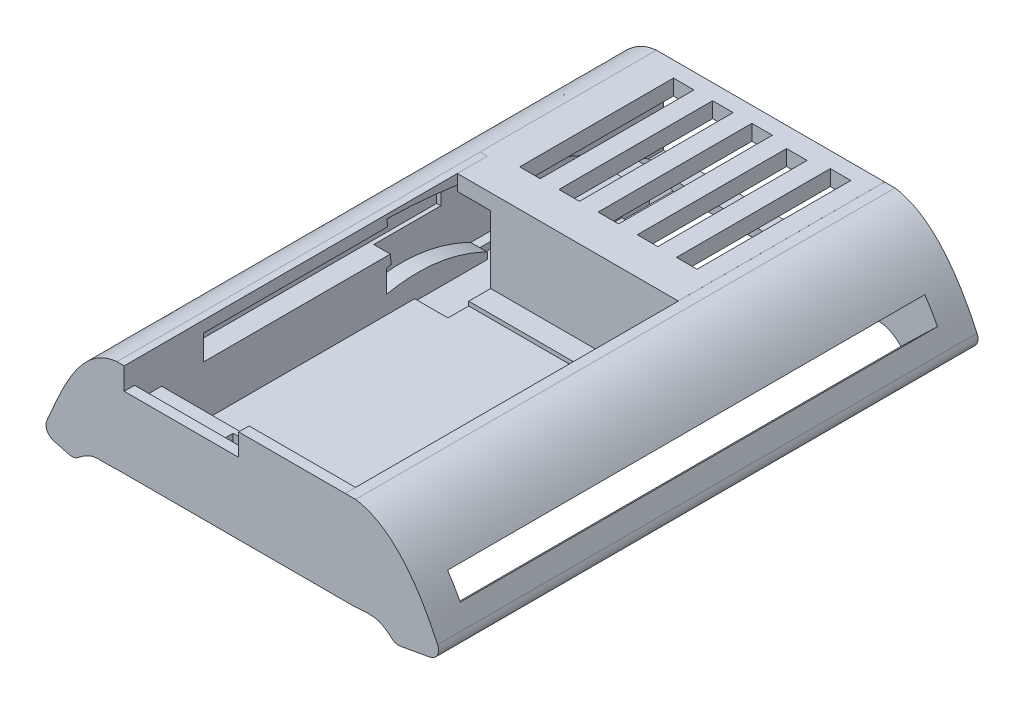
from build123d import *

# Parameters (mm, degrees)
BOSS_EXTRUDE2_DEPTH      = 52
FILLET2_R                = 1
CUT_EXTRUDE2_DEPTH       = 3
CUT_EXTRUDE2_DEPTH_BACK  = 6
SKETCH10_W               = 2.350757351
SKETCH10_H               = 46
SKETCH11_W               = 17
SKETCH11_H               = 15
PELTIER_DEPTH            = 10
SKETCH12_W               = 21
SKETCH12_H               = 29
BATTERY_DEPTH            = 0.4
SKETCH14_W               = 21.3
SKETCH14_H               = 1
BOSS_EXTRUDE4_DEPTH      = 7.999920354
SKETCH15_W               = 3.297714658
SKETCH15_H               = 0.629450307
CUT_EXTRUDE5_DEPTH       = 3.6
SKETCH16_W               = 2.795507754
SKETCH16_H               = 0.669410668
CUT_EXTRUDE6_DEPTH       = 4.337027413
FILLET3_R                = 1
CUT_EXTRUDE7_DEPTH       = 1.6
CUT_EXTRUDE8_DEPTH       = 1.6
FILLET4_R                = 1
FILLET5_R                = 1
SKETCH19_W               = 21.3
SKETCH19_H               = 1
BOSS_EXTRUDE5_DEPTH      = 2.6
SKETCH20_W               = 7.625924169
SKETCH20_H               = 2.120993271
CUT_EXTRUDE9_DEPTH       = 2.6
SKETCH21_W               = 21.3
SKETCH21_H               = 2.886084762
BOSS_EXTRUDE6_DEPTH      = 8
SKETCH22_W               = 17
SKETCH22_H               = 1.5
BOSS_EXTRUDE7_DEPTH      = 22
SKETCH23_W               = 24.481547991
SKETCH23_H               = 2.403526745
CUT_EXTRUDE10_DEPTH      = 2
SKETCH24_W               = 15
SKETCH24_H               = 0.211445756
BOSS_EXTRUDE8_DEPTH      = 2
SKETCH25_W               = 4.787241237
SKETCH25_H               = 0.237383131
BOSS_EXTRUDE9_DEPTH      = 2
SKETCH26_W               = 11.036128308
SKETCH26_H               = 2.126226966
CUT_EXTRUDE11_DEPTH      = 2
CUT_EXTRUDE12_DEPTH      = 2
CUT_EXTRUDE12_DEPTH_BACK = 11
SKETCH27_W               = 46
SKETCH27_H               = 2.33
SKETCH28_W               = 1.978966
SKETCH28_H               = 14.822133623
SKETCH28_H_2             = 14.389327905
SKETCH28_W_2             = 1.978965999
CUT_EXTRUDE13_DEPTH      = 3
SKETCH29_W               = 3.210088646
SKETCH29_H               = 7.129450307
CUT_EXTRUDE14_DEPTH      = 7


with BuildPart() as part:
    # Sketch1 → Boss-Extrude2 (new body)
    with BuildSketch(Plane.XY):
        with BuildLine():
            Line((-4.066957942, -1.190846618), (-7.240355005, -0.354620493))
            add(Edge.make_bspline(
                [(0.042333709, 8.998333002), (-4.213116867, 8.648828695), (-5.962383558, 1.81462105), (-7.240355005, -0.354620493)],
                knots=[0, 0, 0, 0, 1, 1, 1, 1], degree=3))
            Line((0.042333709, 8.998333002), (0.742333709, 8.998333002))
            Line((0.742333709, 8.998333002), (0.742333709, 1))
            Line((0.742333709, 1), (22.042333709, 1))
            Line((22.042333709, 1), (22.042333709, 8.998333002))
            Line((22.042333709, 8.998333002), (23.042333709, 8.998333002))
            add(Edge.make_bspline(
                [(23.042333709, 8.998333002), (27.852391375, 8.27132168), (31.467788923, -0.354620493)],
                knots=[0, 0, 0, 1, 1, 1], degree=2))
            Line((31.467788923, -0.354620493), (26.875523276, -1.190846618))
            add(Edge.make_bspline(
                [(22.86911945, 0), (24.564241842, 0.074416087), (25.297281614, 0.429058332), (26.875523276, -1.190846618)],
                knots=[0, 0, 0, 0, 1, 1, 1, 1], degree=3))
            Line((22.86911945, 0), (0, 0))
            add(Edge.make_bspline(
                [(0, 0), (-1.870814346, -0.163675047), (-2.239916233, 0.430706612), (-4.066957942, -1.190846618)],
                knots=[0, 0, 0, 0, 1, 1, 1, 1], degree=3))
        make_face()
    extrude(amount=BOSS_EXTRUDE2_DEPTH)

    # Fillet2
    fillet2_edges = [part.edges().sort_by_distance(p)[0] for p in [
        (-4.066957942, -1.190846618, 26),
        (-7.240355005, -0.354620493, 26),
    ]]
    fillet(fillet2_edges, radius=FILLET2_R)

    # Sketch10 → Cut-Extrude2 (cut, two sides: drawn at the far end of the back side and taken through both)
    with BuildSketch(Plane(origin=(-4.380890916, 3.569201652, 0), x_dir=(0.631629007569502, 0.7752707893354205, 0), z_dir=(-0.7752707893354205, 0.631629007569502, 0)).offset(-CUT_EXTRUDE2_DEPTH_BACK)):
        with Locations((-1.831509184, -27)):
            Rectangle(SKETCH10_W, SKETCH10_H)
    extrude(amount=CUT_EXTRUDE2_DEPTH + CUT_EXTRUDE2_DEPTH_BACK, mode=Mode.SUBTRACT)

    # Sketch11 → Peltier (cut)
    with BuildSketch(Plane(origin=(0, 1, 0), x_dir=(1, 0, 0), z_dir=(0, 1, 0))):
        with Locations((12.114692368, -9.5)):
            Rectangle(SKETCH11_W, SKETCH11_H)
    extrude(amount=-PELTIER_DEPTH, mode=Mode.SUBTRACT)

    # Sketch12 → Battery (cut)
    with BuildSketch(Plane(origin=(0, 1, 0), x_dir=(1, 0, 0), z_dir=(0, 1, 0))):
        with Locations((11.242333709, -36.5)):
            Rectangle(SKETCH12_W, SKETCH12_H)
    extrude(amount=-BATTERY_DEPTH, mode=Mode.SUBTRACT)

    # Sketch14 → Boss-Extrude4 (add)
    with BuildSketch(Plane(origin=(0, 1, 0), x_dir=(1, 0, 0), z_dir=(0, 1, 0))):
        with Locations((11.392333709, -51.5)):
            Rectangle(SKETCH14_W, SKETCH14_H)
    extrude(amount=BOSS_EXTRUDE4_DEPTH)

    # Sketch15 → Cut-Extrude5 (cut)
    with BuildSketch(Plane(origin=(3.614692368, 0, 0), x_dir=(0, 0, -1), z_dir=(1, 0, 0))):
        with Locations((-15.351142671, 0.685274847)):
            Rectangle(SKETCH15_W, SKETCH15_H)
    extrude(amount=-CUT_EXTRUDE5_DEPTH, mode=Mode.SUBTRACT)

    # Sketch16 → Cut-Extrude6 (cut)
    with BuildSketch(Plane(origin=(3.614692368, 0, 0), x_dir=(0, 0, -1), z_dir=(1, 0, 0))):
        with Locations((-2.862635658, 0.665294666)):
            Rectangle(SKETCH16_W, SKETCH16_H)
    extrude(amount=-CUT_EXTRUDE6_DEPTH, mode=Mode.SUBTRACT)

    # Fillet3
    # the kernel refuses this fillet: 1 mm, written as the material it takes off along each edge
    with BuildSketch(Plane(origin=(3.614692368, 0.330589332, 2), x_dir=(0, -1, 0), z_dir=(0, 0, 1))) as fillet3_piece_1:
        with BuildLine():
            CenterArc((1, -0.742892561), FILLET3_R, 132.021596152, 47.978403848)
            Line((0, -0.742892561), (0, 0))
            Line((0, 0), (0.330589332, 0))
        make_face()
    extrude(amount=2.260389535, mode=Mode.SUBTRACT)
    with BuildSketch(Plane(origin=(3.614692368, 0.370549693, 17), x_dir=(0, -1, 0), z_dir=(0, 0, -1))) as fillet3_piece_2:
        with BuildLine():
            CenterArc((1, 0.77704074), FILLET3_R, 180, 50.990421184)
            Line((0, 0.77704074), (0, 0))
            Line((0, 0), (0.370549693, 0))
        make_face()
    extrude(amount=3.297714658, mode=Mode.SUBTRACT)

    # Sketch17 → Cut-Extrude7 (cut)
    with BuildSketch(Plane(origin=(0.742333709, 0, 0), x_dir=(0, 0, -1), z_dir=(1, 0, 0))):
        with BuildLine():
            Line((-26.679947222, 8.607264172), (-26.2562675, 4.600305927))
            add(Edge.make_bspline(
                [(-11.956359989, 1), (-18.174048642, 5.645894808), (-26.2562675, 4.600305927)],
                knots=[0, 0, 0, 1, 1, 1], degree=2))
            Line((-11.956359989, 1), (-1.464881781, 1))
            add(Edge.make_bspline(
                [(-1.464881781, 1), (-12.835212302, 8.374655541), (-26.679947222, 8.607264172)],
                knots=[0, 0, 0, 1, 1, 1], degree=2))
        make_face()
    extrude(amount=-CUT_EXTRUDE7_DEPTH, mode=Mode.SUBTRACT)

    # Sketch18 → Cut-Extrude8 (cut)
    with BuildSketch(Plane(origin=(0.742333709, 0, 0), x_dir=(0, 0, -1), z_dir=(1, 0, 0))):
        with BuildLine():
            Line((-26.709406335, 2.333242891), (-26.709406335, 4.472060633))
            add(Edge.make_bspline(
                [(-10.082290903, 1), (-18.147687182, 7.131693783), (-26.709406335, 4.472060633)],
                knots=[0, 0, 0, 1, 1, 1], degree=2))
            Line((-10.082290903, 1), (-17, 1))
            add(Edge.make_bspline(
                [(-17, 1), (-21.703390607, 3.354733642), (-26.709406335, 2.333242891)],
                knots=[0, 0, 0, 1, 1, 1], degree=2))
        make_face()
    extrude(amount=-CUT_EXTRUDE8_DEPTH, mode=Mode.SUBTRACT)

    # Fillet4
    fillet4_edges = [part.edges().sort_by_distance(p)[0] for p in [
        (26.875523276, -1.190846618, 26),
    ]]
    fillet(fillet4_edges, radius=FILLET4_R)

    # Fillet5
    fillet5_edges = [part.edges().sort_by_distance(p)[0] for p in [
        (31.467788923, -0.354620493, 26),
    ]]
    fillet(fillet5_edges, radius=FILLET5_R)

    # Sketch19 → Boss-Extrude5 (add)
    with BuildSketch(Plane(origin=(0, 0, 51), x_dir=(-1, 0, 0), z_dir=(0, 0, -1))):
        with Locations((-11.392333709, 5)):
            Rectangle(SKETCH19_W, SKETCH19_H)
    extrude(amount=BOSS_EXTRUDE5_DEPTH)

    # Sketch20 → Cut-Extrude9 (cut)
    with BuildSketch(Plane(origin=(0, 5.5, 0), x_dir=(1, 0, 0), z_dir=(0, 1, 0))):
        with Locations((11.936871332, -49.939503364)):
            Rectangle(SKETCH20_W, SKETCH20_H)
    extrude(amount=-CUT_EXTRUDE9_DEPTH, mode=Mode.SUBTRACT)

    # Sketch21 → Boss-Extrude6 (add)
    with BuildSketch(Plane(origin=(0, 1, 0), x_dir=(1, 0, 0), z_dir=(0, 1, 0))):
        with Locations((11.392333709, -18.443042381)):
            Rectangle(SKETCH21_W, SKETCH21_H)
    extrude(amount=BOSS_EXTRUDE6_DEPTH)

    # Sketch22 → Boss-Extrude7 (add)
    with BuildSketch(Plane.ZY.offset(-22.042333709)):
        with Locations((8.5, 8.25)):
            Rectangle(SKETCH22_W, SKETCH22_H)
    extrude(amount=BOSS_EXTRUDE7_DEPTH)

    # Sketch23 → Cut-Extrude10 (cut)
    with BuildSketch(Plane(origin=(0.742333709, 0, 0), x_dir=(0, 0, -1), z_dir=(1, 0, 0))):
        with Locations((-32.126858758, 6.701763373)):
            Rectangle(SKETCH23_W, SKETCH23_H)
    extrude(amount=-CUT_EXTRUDE10_DEPTH, mode=Mode.SUBTRACT)

    # Sketch24 → Boss-Extrude8 (add)
    with BuildSketch(Plane.ZY.offset(-20.614692368)):
        with Locations((9.5, 0.105722878)):
            Rectangle(SKETCH24_W, SKETCH24_H)
    extrude(amount=BOSS_EXTRUDE8_DEPTH)

    # Sketch25 → Boss-Extrude9 (add)
    with BuildSketch(Plane(origin=(3.614692368, 0, 0), x_dir=(0, 0, -1), z_dir=(1, 0, 0))):
        with Locations((-9.281203123, 0.118691566)):
            Rectangle(SKETCH25_W, SKETCH25_H)
    extrude(amount=BOSS_EXTRUDE9_DEPTH)

    # Sketch26 → Cut-Extrude11 (cut)
    with BuildSketch(Plane(origin=(0, 0, 51), x_dir=(-1, 0, 0), z_dir=(0, 0, -1))):
        with Locations((-6.260397863, 7.936806871)):
            Rectangle(SKETCH26_W, SKETCH26_H)
    extrude(amount=-CUT_EXTRUDE11_DEPTH, mode=Mode.SUBTRACT)

    # Sketch27 → Cut-Extrude12 (cut, two sides: drawn at the far end of the back side and taken through both)
    with BuildSketch(Plane(origin=(16.401330443, 15.864191281, 0), x_dir=(0, 0, -1), z_dir=(0.7187787233935905, 0.6952389134654938, 0)).offset(-CUT_EXTRUDE12_DEPTH_BACK)):
        with Locations((-26, -18.013212029)):
            Rectangle(SKETCH27_W, SKETCH27_H)
    extrude(amount=CUT_EXTRUDE12_DEPTH + CUT_EXTRUDE12_DEPTH_BACK, mode=Mode.SUBTRACT)

    # Sketch28 → Cut-Extrude13 (cut)
    with BuildSketch(Plane(origin=(0, 9, 0), x_dir=(1, 0, 0), z_dir=(0, 1, 0))):
        with Locations((19.299375066, -8.918059871)):
            Rectangle(SKETCH28_W, SKETCH28_H)
        with Locations((15.520409066, -9.13446273)):
            Rectangle(SKETCH28_W, SKETCH28_H_2)
        with Locations((11.741443067, -8.918059871)):
            Rectangle(SKETCH28_W_2, SKETCH28_H)
        with Locations((7.962477067, -8.918059871)):
            Rectangle(SKETCH28_W, SKETCH28_H)
        with Locations((4.183511067, -8.918059871)):
            Rectangle(SKETCH28_W, SKETCH28_H)
    extrude(amount=-CUT_EXTRUDE13_DEPTH, mode=Mode.SUBTRACT)

    # Sketch29 → Cut-Extrude14 (cut)
    with BuildSketch(Plane(origin=(0, 0, 17), x_dir=(-1, 0, 0), z_dir=(0, 0, -1))):
        with Locations((-2.347378032, 3.935274847)):
            Rectangle(SKETCH29_W, SKETCH29_H)
    extrude(amount=-CUT_EXTRUDE14_DEPTH, mode=Mode.SUBTRACT)


solid = part.part
